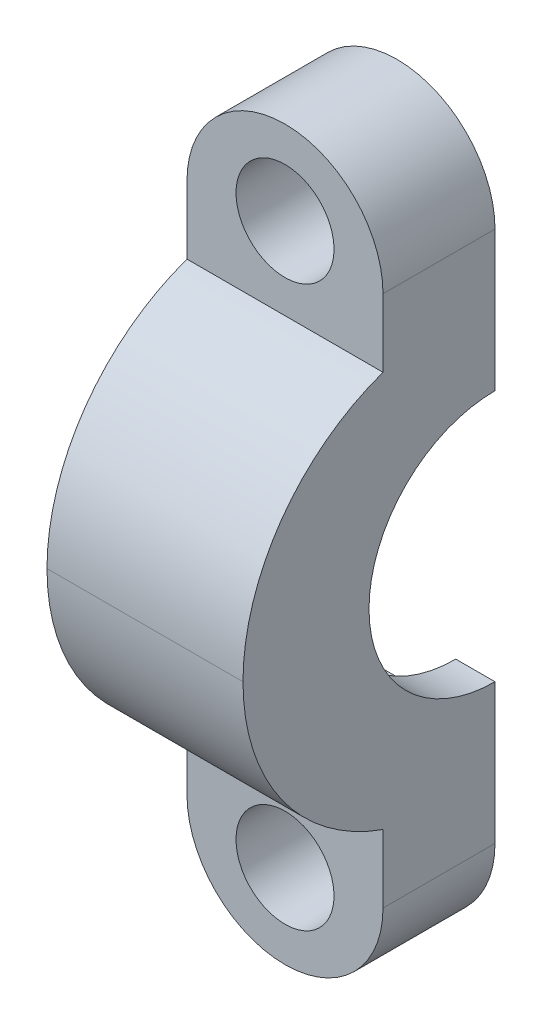
from build123d import *

# Parameters (mm, degrees)
SKETCH1_W               = 7
SKETCH1_H               = 15
BOSS_EXTRUDE1_DEPTH     = 9
SKETCH2_R               = 4.5
CUT_EXTRUDE1_DEPTH      = 14.647344064
CUT_EXTRUDE2_DEPTH      = 2.1
CUT_EXTRUDE2_DEPTH_BACK = 2.1
SKETCH3_R               = 6.1
FILLET1_R               = 7.5
BOSS_EXTRUDE2_DEPTH     = 4
SKETCH5_R               = 1.75
CUT_EXTRUDE3_DEPTH      = 17.194134741


with BuildPart() as part:
    # Sketch1 → Boss-Extrude1 (new body)
    with BuildSketch(Plane.XY):
        Rectangle(SKETCH1_W, SKETCH1_H)
    extrude(amount=BOSS_EXTRUDE1_DEPTH)

    # Sketch2 → Cut-Extrude1 (cut, through all)
    with BuildSketch(Plane(origin=(3.5, 0, 0), x_dir=(0, 0, -1), z_dir=(1, 0, 0))):
        Circle(SKETCH2_R)
    extrude(amount=-CUT_EXTRUDE1_DEPTH, mode=Mode.SUBTRACT)

    # Sketch3 → Cut-Extrude2 (cut, two sides: drawn at the far end of the back side and taken through both)
    with BuildSketch(Plane(origin=(0, 0, 0), x_dir=(0, 0, -1), z_dir=(1, 0, 0)).offset(-CUT_EXTRUDE2_DEPTH_BACK)):
        Circle(SKETCH3_R)
    extrude(amount=CUT_EXTRUDE2_DEPTH + CUT_EXTRUDE2_DEPTH_BACK, mode=Mode.SUBTRACT)

    # Fillet1
    fillet1_edges = [part.edges().sort_by_distance(p)[0] for p in [
        (0, -7.5, 9),
        (0, 7.5, 9),
    ]]
    fillet(fillet1_edges, radius=FILLET1_R - 0.0001)  # a hair under: the kernel refuses the full size

    # Sketch4 → Boss-Extrude2 (add)
    with BuildSketch(Plane.XY):
        with BuildLine():
            Line((-3.5, 6.507281557), (-3.5, 9.5))
            ThreePointArc((-3.5, 9.5), (0, 13), (3.5, 9.5))
            Line((3.5, 9.5), (3.5, 6.507281557))
            Line((3.5, 6.507281557), (-3.5, 6.507281557))
        make_face()
    boss_extrude2 = extrude(amount=BOSS_EXTRUDE2_DEPTH)

    # Sketch5 → Cut-Extrude3 (cut, through all)
    with BuildSketch(Plane(origin=(0, 0, 0), x_dir=(-1, 0, 0), z_dir=(0, 0, -1))):
        with Locations((0, 10)):
            Circle(SKETCH5_R)
    cut_extrude3 = extrude(amount=-CUT_EXTRUDE3_DEPTH, mode=Mode.SUBTRACT)

    # Mirror1: Boss-Extrude2, Cut-Extrude3 across plane
    add(boss_extrude2.mirror(Plane.ZX))
    add(cut_extrude3.mirror(Plane.ZX), mode=Mode.SUBTRACT)


solid = part.part
